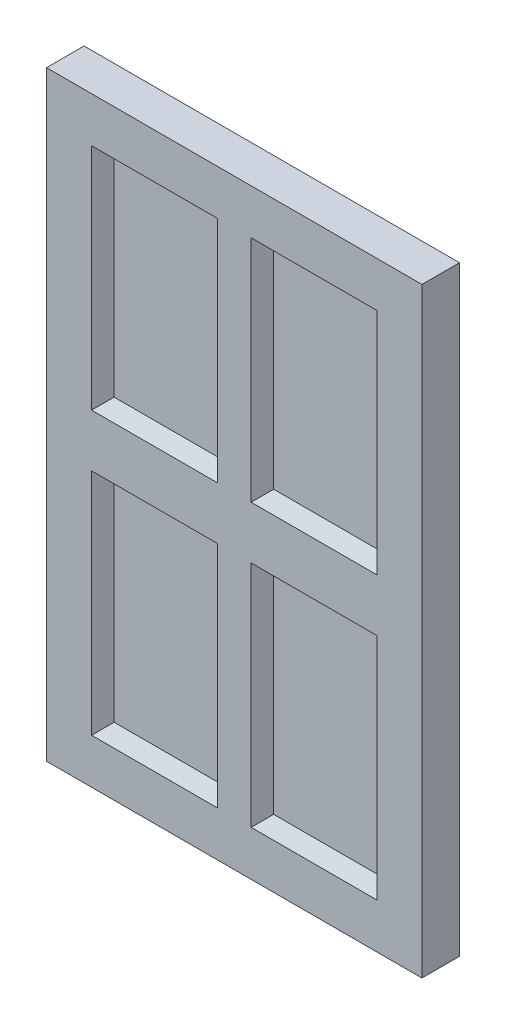
from build123d import *

# Parameters (mm, degrees)
SKETCH1_W               = 100
SKETCH1_H               = 160
BOSS_EXTRUDE1_DEPTH     = 10
SKETCH2_W               = 37.5
SKETCH2_H               = 65
CUT_EXTRUDE1_DEPTH      = 3
MIRROR6_COPY_1_SKETCH_W = 37.5
MIRROR6_COPY_1_SKETCH_H = 65
MIRROR6_COPY_1_DEPTH    = 3
MIRROR7_COPY_1_SKETCH_W = 37.5
MIRROR7_COPY_1_SKETCH_H = 65
MIRROR7_COPY_1_DEPTH    = 3
MIRROR7_COPY_2_SKETCH_W = 37.5
MIRROR7_COPY_2_SKETCH_H = 65
MIRROR7_COPY_2_DEPTH    = 3
MIRROR7_COPY_3_SKETCH_W = 37.5
MIRROR7_COPY_3_SKETCH_H = 65
MIRROR7_COPY_3_DEPTH    = 3
CHAMFER2_SIZE           = 5


with BuildPart() as part:
    # Sketch1 → Boss-Extrude1 (new body)
    with BuildSketch(Plane.XY):
        Rectangle(SKETCH1_W, SKETCH1_H)
    extrude(amount=BOSS_EXTRUDE1_DEPTH)

    # Sketch2 → Cut-Extrude1 (cut)
    with BuildSketch(Plane.XY.offset(10)):
        with Locations((21.25, 37.5)):
            Rectangle(SKETCH2_W, SKETCH2_H)
    cut_extrude1 = extrude(amount=-CUT_EXTRUDE1_DEPTH, mode=Mode.SUBTRACT)

    # Mirror5: Cut-Extrude1 across plane
    add(cut_extrude1.mirror(Plane.ZX), mode=Mode.SUBTRACT)

    # Mirror6: Cut-Extrude1 across plane
    add(cut_extrude1.mirror(Plane(origin=(0, 0, 0), x_dir=(0, 0, 1), z_dir=(1, 0, 0))), mode=Mode.SUBTRACT)

    # Mirror6 copy 1 sketch → Mirror6 copy 1 (cut)
    with BuildSketch(Plane(origin=(0, 0, 10), x_dir=(-1, 0, 0), z_dir=(0, 0, 1))):
        with Locations((21.25, 37.5)):
            Rectangle(MIRROR6_COPY_1_SKETCH_W, MIRROR6_COPY_1_SKETCH_H)
    extrude(amount=-MIRROR6_COPY_1_DEPTH, mode=Mode.SUBTRACT)

    # Mirror7: Cut-Extrude1 across plane
    add(cut_extrude1.mirror(Plane.XY.offset(5)), mode=Mode.SUBTRACT)

    # Mirror7 copy 1 sketch → Mirror7 copy 1 (cut)
    with BuildSketch(Plane(origin=(0, 0, 0), x_dir=(1, 0, 0), z_dir=(0, 0, -1))):
        with Locations((21.25, 37.5)):
            Rectangle(MIRROR7_COPY_1_SKETCH_W, MIRROR7_COPY_1_SKETCH_H)
    extrude(amount=-MIRROR7_COPY_1_DEPTH, mode=Mode.SUBTRACT)

    # Mirror7 copy 2 sketch → Mirror7 copy 2 (cut)
    with BuildSketch(Plane(origin=(0, 0, 0), x_dir=(-1, 0, 0), z_dir=(0, 0, -1))):
        with Locations((21.25, 37.5)):
            Rectangle(MIRROR7_COPY_2_SKETCH_W, MIRROR7_COPY_2_SKETCH_H)
    extrude(amount=-MIRROR7_COPY_2_DEPTH, mode=Mode.SUBTRACT)

    # Mirror7 copy 3 sketch → Mirror7 copy 3 (cut)
    with BuildSketch(Plane(origin=(0, 0, 0), x_dir=(-1, 0, 0), z_dir=(0, 0, -1))):
        with Locations((21.25, -37.5)):
            Rectangle(MIRROR7_COPY_3_SKETCH_W, MIRROR7_COPY_3_SKETCH_H)
    extrude(amount=-MIRROR7_COPY_3_DEPTH, mode=Mode.SUBTRACT)

    # Chamfer2
    # the kernel refuses this chamfer: 5 mm, written as the material it adds along each edge
    with BuildSketch(Plane(origin=(10.35841494, -5, 3), x_dir=(0, 0.027495876610586317, -0.9996219169112968), z_dir=(-1, 0, 0))) as chamfer2_piece_1_section:
        Polygon((CHAMFER2_SIZE * 0.999621916911, CHAMFER2_SIZE * 0.0274958766106), (-CHAMFER2_SIZE * 0.0274958766106, CHAMFER2_SIZE * 0.999621916911), (0, 0), align=None)
    chamfer2_piece_1 = extrude(amount=50.35841494, mode=Mode.PRIVATE)
    chamfer2_piece_1 = split(chamfer2_piece_1, bisect_by=Plane(origin=(6.42920747, -6.857142857, 0), z_dir=(0, 0, 1)), keep=Keep.TOP, mode=Mode.PRIVATE)
    add(chamfer2_piece_1)
    with BuildSketch(Plane(origin=(-40, 7.85841494, 3), x_dir=(-0.027495876610586317, 0, -0.9996219169112968), z_dir=(0, -1, 0))) as chamfer2_piece_2_section:
        Polygon((CHAMFER2_SIZE * 0.999621916911, CHAMFER2_SIZE * 0.0274958766106), (-CHAMFER2_SIZE * 0.0274958766106, CHAMFER2_SIZE * 0.999621916911), (0, 0), align=None)
    chamfer2_piece_2 = extrude(amount=77.85841494, mode=Mode.PRIVATE)
    chamfer2_piece_2 = split(chamfer2_piece_2, bisect_by=Plane(origin=(-38.142857143, 6.42920747, 0), z_dir=(0, 0, 1)), keep=Keep.TOP, mode=Mode.PRIVATE)
    add(chamfer2_piece_2)
    with BuildSketch(Plane(origin=(-40, -70, 3), x_dir=(0, -0.0274958766105877, -0.9996219169112968), z_dir=(1, 0, 0))) as chamfer2_piece_3_section:
        Polygon((CHAMFER2_SIZE * 0.999621916911, CHAMFER2_SIZE * 0.0274958766106), (-CHAMFER2_SIZE * 0.0274958766106, CHAMFER2_SIZE * 0.999621916911), (0, 0), align=None)
    chamfer2_piece_3 = extrude(amount=50.35841494, mode=Mode.PRIVATE)
    chamfer2_piece_3 = split(chamfer2_piece_3, bisect_by=Plane(origin=(-21.25, -68.142857143, 0), z_dir=(0, 0, 1)), keep=Keep.TOP, mode=Mode.PRIVATE)
    add(chamfer2_piece_3)
    with BuildSketch(Plane(origin=(-2.5, -70, 3), x_dir=(0.027495876610586403, 0, -0.9996219169112968), z_dir=(0, 1, 0))) as chamfer2_piece_4_section:
        Polygon((CHAMFER2_SIZE * 0.999621916911, CHAMFER2_SIZE * 0.0274958766106), (-CHAMFER2_SIZE * 0.0274958766106, CHAMFER2_SIZE * 0.999621916911), (0, 0), align=None)
    chamfer2_piece_4 = extrude(amount=77.85841494, mode=Mode.PRIVATE)
    chamfer2_piece_4 = split(chamfer2_piece_4, bisect_by=Plane(origin=(-4.357142857, -37.5, 0), z_dir=(0, 0, 1)), keep=Keep.TOP, mode=Mode.PRIVATE)
    add(chamfer2_piece_4)
    with BuildSketch(Plane(origin=(-40, -70, 7), x_dir=(0, -0.0274958766105877, 0.9996219169112968), z_dir=(1, 0, 0))) as chamfer2_piece_5_section:
        Polygon((CHAMFER2_SIZE * 0.999621916911, -CHAMFER2_SIZE * 0.0274958766106), (-CHAMFER2_SIZE * 0.0274958766106, -CHAMFER2_SIZE * 0.999621916911), (0, 0), align=None)
    chamfer2_piece_5 = extrude(amount=50.35841494, mode=Mode.PRIVATE)
    chamfer2_piece_5 = split(chamfer2_piece_5, bisect_by=Plane(origin=(-21.25, -68.142857143, 10), z_dir=(0, 0, -1)), keep=Keep.TOP, mode=Mode.PRIVATE)
    add(chamfer2_piece_5)
    with BuildSketch(Plane(origin=(-40, 7.85841494, 7), x_dir=(-0.027495876610586317, 0, 0.9996219169112968), z_dir=(0, -1, 0))) as chamfer2_piece_6_section:
        Polygon((CHAMFER2_SIZE * 0.999621916911, -CHAMFER2_SIZE * 0.0274958766106), (-CHAMFER2_SIZE * 0.0274958766106, -CHAMFER2_SIZE * 0.999621916911), (0, 0), align=None)
    chamfer2_piece_6 = extrude(amount=77.85841494, mode=Mode.PRIVATE)
    chamfer2_piece_6 = split(chamfer2_piece_6, bisect_by=Plane(origin=(-38.142857143, 6.42920747, 10), z_dir=(0, 0, -1)), keep=Keep.TOP, mode=Mode.PRIVATE)
    add(chamfer2_piece_6)
    with BuildSketch(Plane(origin=(10.35841494, -5, 7), x_dir=(0, 0.027495876610586317, 0.9996219169112968), z_dir=(-1, 0, 0))) as chamfer2_piece_7_section:
        Polygon((CHAMFER2_SIZE * 0.999621916911, -CHAMFER2_SIZE * 0.0274958766106), (-CHAMFER2_SIZE * 0.0274958766106, -CHAMFER2_SIZE * 0.999621916911), (0, 0), align=None)
    chamfer2_piece_7 = extrude(amount=50.35841494, mode=Mode.PRIVATE)
    chamfer2_piece_7 = split(chamfer2_piece_7, bisect_by=Plane(origin=(6.42920747, -6.857142857, 10), z_dir=(0, 0, -1)), keep=Keep.TOP, mode=Mode.PRIVATE)
    add(chamfer2_piece_7)
    with BuildSketch(Plane(origin=(-2.5, -70, 7), x_dir=(0.027495876610586403, 0, 0.9996219169112968), z_dir=(0, 1, 0))) as chamfer2_piece_8_section:
        Polygon((CHAMFER2_SIZE * 0.999621916911, -CHAMFER2_SIZE * 0.0274958766106), (-CHAMFER2_SIZE * 0.0274958766106, -CHAMFER2_SIZE * 0.999621916911), (0, 0), align=None)
    chamfer2_piece_8 = extrude(amount=77.85841494, mode=Mode.PRIVATE)
    chamfer2_piece_8 = split(chamfer2_piece_8, bisect_by=Plane(origin=(-4.357142857, -37.5, 10), z_dir=(0, 0, -1)), keep=Keep.TOP, mode=Mode.PRIVATE)
    add(chamfer2_piece_8)
    with BuildSketch(Plane(origin=(-10.35841494, 5, 3), x_dir=(0, -0.027495876610586317, -0.9996219169112968), z_dir=(1, 0, 0))) as chamfer2_piece_9_section:
        Polygon((CHAMFER2_SIZE * 0.999621916911, CHAMFER2_SIZE * 0.0274958766106), (-CHAMFER2_SIZE * 0.0274958766106, CHAMFER2_SIZE * 0.999621916911), (0, 0), align=None)
    chamfer2_piece_9 = extrude(amount=50.35841494, mode=Mode.PRIVATE)
    chamfer2_piece_9 = split(chamfer2_piece_9, bisect_by=Plane(origin=(-6.42920747, 6.857142857, 0), z_dir=(0, 0, 1)), keep=Keep.TOP, mode=Mode.PRIVATE)
    add(chamfer2_piece_9)
    with BuildSketch(Plane(origin=(40, -7.85841494, 3), x_dir=(0.027495876610586317, 0, -0.9996219169112968), z_dir=(0, 1, 0))) as chamfer2_piece_10_section:
        Polygon((CHAMFER2_SIZE * 0.999621916911, CHAMFER2_SIZE * 0.0274958766106), (-CHAMFER2_SIZE * 0.0274958766106, CHAMFER2_SIZE * 0.999621916911), (0, 0), align=None)
    chamfer2_piece_10 = extrude(amount=77.85841494, mode=Mode.PRIVATE)
    chamfer2_piece_10 = split(chamfer2_piece_10, bisect_by=Plane(origin=(38.142857143, -6.42920747, 0), z_dir=(0, 0, 1)), keep=Keep.TOP, mode=Mode.PRIVATE)
    add(chamfer2_piece_10)
    with BuildSketch(Plane(origin=(40, 70, 3), x_dir=(0, 0.0274958766105877, -0.9996219169112968), z_dir=(-1, 0, 0))) as chamfer2_piece_11_section:
        Polygon((CHAMFER2_SIZE * 0.999621916911, CHAMFER2_SIZE * 0.0274958766106), (-CHAMFER2_SIZE * 0.0274958766106, CHAMFER2_SIZE * 0.999621916911), (0, 0), align=None)
    chamfer2_piece_11 = extrude(amount=50.35841494, mode=Mode.PRIVATE)
    chamfer2_piece_11 = split(chamfer2_piece_11, bisect_by=Plane(origin=(21.25, 68.142857143, 0), z_dir=(0, 0, 1)), keep=Keep.TOP, mode=Mode.PRIVATE)
    add(chamfer2_piece_11)
    with BuildSketch(Plane(origin=(2.5, 70, 3), x_dir=(-0.027495876610586403, 0, -0.9996219169112968), z_dir=(0, -1, 0))) as chamfer2_piece_12_section:
        Polygon((CHAMFER2_SIZE * 0.999621916911, CHAMFER2_SIZE * 0.0274958766106), (-CHAMFER2_SIZE * 0.0274958766106, CHAMFER2_SIZE * 0.999621916911), (0, 0), align=None)
    chamfer2_piece_12 = extrude(amount=77.85841494, mode=Mode.PRIVATE)
    chamfer2_piece_12 = split(chamfer2_piece_12, bisect_by=Plane(origin=(4.357142857, 37.5, 0), z_dir=(0, 0, 1)), keep=Keep.TOP, mode=Mode.PRIVATE)
    add(chamfer2_piece_12)
    with BuildSketch(Plane(origin=(-40, 70, 3), x_dir=(0, 0.0274958766105877, -0.9996219169112968), z_dir=(1, 0, 0))) as chamfer2_piece_13_section:
        Polygon((CHAMFER2_SIZE * 0.999621916911, -CHAMFER2_SIZE * 0.0274958766106), (-CHAMFER2_SIZE * 0.0274958766106, -CHAMFER2_SIZE * 0.999621916911), (0, 0), align=None)
    chamfer2_piece_13 = extrude(amount=50.35841494, mode=Mode.PRIVATE)
    chamfer2_piece_13 = split(chamfer2_piece_13, bisect_by=Plane(origin=(-21.25, 68.142857143, 0), z_dir=(0, 0, 1)), keep=Keep.TOP, mode=Mode.PRIVATE)
    add(chamfer2_piece_13)
    with BuildSketch(Plane(origin=(-40, -7.85841494, 3), x_dir=(-0.027495876610586317, 0, -0.9996219169112968), z_dir=(0, 1, 0))) as chamfer2_piece_14_section:
        Polygon((CHAMFER2_SIZE * 0.999621916911, -CHAMFER2_SIZE * 0.0274958766106), (-CHAMFER2_SIZE * 0.0274958766106, -CHAMFER2_SIZE * 0.999621916911), (0, 0), align=None)
    chamfer2_piece_14 = extrude(amount=77.85841494, mode=Mode.PRIVATE)
    chamfer2_piece_14 = split(chamfer2_piece_14, bisect_by=Plane(origin=(-38.142857143, -6.42920747, 0), z_dir=(0, 0, 1)), keep=Keep.TOP, mode=Mode.PRIVATE)
    add(chamfer2_piece_14)
    with BuildSketch(Plane(origin=(10.35841494, 5, 3), x_dir=(0, -0.027495876610586317, -0.9996219169112968), z_dir=(-1, 0, 0))) as chamfer2_piece_15_section:
        Polygon((CHAMFER2_SIZE * 0.999621916911, -CHAMFER2_SIZE * 0.0274958766106), (-CHAMFER2_SIZE * 0.0274958766106, -CHAMFER2_SIZE * 0.999621916911), (0, 0), align=None)
    chamfer2_piece_15 = extrude(amount=50.35841494, mode=Mode.PRIVATE)
    chamfer2_piece_15 = split(chamfer2_piece_15, bisect_by=Plane(origin=(6.42920747, 6.857142857, 0), z_dir=(0, 0, 1)), keep=Keep.TOP, mode=Mode.PRIVATE)
    add(chamfer2_piece_15)
    with BuildSketch(Plane(origin=(-2.5, 70, 3), x_dir=(0.027495876610586403, 0, -0.9996219169112968), z_dir=(0, -1, 0))) as chamfer2_piece_16_section:
        Polygon((CHAMFER2_SIZE * 0.999621916911, -CHAMFER2_SIZE * 0.0274958766106), (-CHAMFER2_SIZE * 0.0274958766106, -CHAMFER2_SIZE * 0.999621916911), (0, 0), align=None)
    chamfer2_piece_16 = extrude(amount=77.85841494, mode=Mode.PRIVATE)
    chamfer2_piece_16 = split(chamfer2_piece_16, bisect_by=Plane(origin=(-4.357142857, 37.5, 0), z_dir=(0, 0, 1)), keep=Keep.TOP, mode=Mode.PRIVATE)
    add(chamfer2_piece_16)
    with BuildSketch(Plane(origin=(40, -70, 3), x_dir=(0, -0.0274958766105877, -0.9996219169112968), z_dir=(-1, 0, 0))) as chamfer2_piece_17_section:
        Polygon((CHAMFER2_SIZE * 0.999621916911, -CHAMFER2_SIZE * 0.0274958766106), (-CHAMFER2_SIZE * 0.0274958766106, -CHAMFER2_SIZE * 0.999621916911), (0, 0), align=None)
    chamfer2_piece_17 = extrude(amount=50.35841494, mode=Mode.PRIVATE)
    chamfer2_piece_17 = split(chamfer2_piece_17, bisect_by=Plane(origin=(21.25, -68.142857143, 0), z_dir=(0, 0, 1)), keep=Keep.TOP, mode=Mode.PRIVATE)
    add(chamfer2_piece_17)
    with BuildSketch(Plane(origin=(40, 7.85841494, 3), x_dir=(0.027495876610586317, 0, -0.9996219169112968), z_dir=(0, -1, 0))) as chamfer2_piece_18_section:
        Polygon((CHAMFER2_SIZE * 0.999621916911, -CHAMFER2_SIZE * 0.0274958766106), (-CHAMFER2_SIZE * 0.0274958766106, -CHAMFER2_SIZE * 0.999621916911), (0, 0), align=None)
    chamfer2_piece_18 = extrude(amount=77.85841494, mode=Mode.PRIVATE)
    chamfer2_piece_18 = split(chamfer2_piece_18, bisect_by=Plane(origin=(38.142857143, 6.42920747, 0), z_dir=(0, 0, 1)), keep=Keep.TOP, mode=Mode.PRIVATE)
    add(chamfer2_piece_18)
    with BuildSketch(Plane(origin=(-10.35841494, -5, 3), x_dir=(0, 0.027495876610586317, -0.9996219169112968), z_dir=(1, 0, 0))) as chamfer2_piece_19_section:
        Polygon((CHAMFER2_SIZE * 0.999621916911, -CHAMFER2_SIZE * 0.0274958766106), (-CHAMFER2_SIZE * 0.0274958766106, -CHAMFER2_SIZE * 0.999621916911), (0, 0), align=None)
    chamfer2_piece_19 = extrude(amount=50.35841494, mode=Mode.PRIVATE)
    chamfer2_piece_19 = split(chamfer2_piece_19, bisect_by=Plane(origin=(-6.42920747, -6.857142857, 0), z_dir=(0, 0, 1)), keep=Keep.TOP, mode=Mode.PRIVATE)
    add(chamfer2_piece_19)
    with BuildSketch(Plane(origin=(2.5, -70, 3), x_dir=(-0.027495876610586403, 0, -0.9996219169112968), z_dir=(0, 1, 0))) as chamfer2_piece_20_section:
        Polygon((CHAMFER2_SIZE * 0.999621916911, -CHAMFER2_SIZE * 0.0274958766106), (-CHAMFER2_SIZE * 0.0274958766106, -CHAMFER2_SIZE * 0.999621916911), (0, 0), align=None)
    chamfer2_piece_20 = extrude(amount=77.85841494, mode=Mode.PRIVATE)
    chamfer2_piece_20 = split(chamfer2_piece_20, bisect_by=Plane(origin=(4.357142857, -37.5, 0), z_dir=(0, 0, 1)), keep=Keep.TOP, mode=Mode.PRIVATE)
    add(chamfer2_piece_20)
    with BuildSketch(Plane(origin=(-10.35841494, -5, 7), x_dir=(0, 0.027495876610586317, 0.9996219169112968), z_dir=(1, 0, 0))) as chamfer2_piece_21_section:
        Polygon((CHAMFER2_SIZE * 0.999621916911, CHAMFER2_SIZE * 0.0274958766106), (-CHAMFER2_SIZE * 0.0274958766106, CHAMFER2_SIZE * 0.999621916911), (0, 0), align=None)
    chamfer2_piece_21 = extrude(amount=50.35841494, mode=Mode.PRIVATE)
    chamfer2_piece_21 = split(chamfer2_piece_21, bisect_by=Plane(origin=(-6.42920747, -6.857142857, 10), z_dir=(0, 0, -1)), keep=Keep.TOP, mode=Mode.PRIVATE)
    add(chamfer2_piece_21)
    with BuildSketch(Plane(origin=(40, 7.85841494, 7), x_dir=(0.027495876610586317, 0, 0.9996219169112968), z_dir=(0, -1, 0))) as chamfer2_piece_22_section:
        Polygon((CHAMFER2_SIZE * 0.999621916911, CHAMFER2_SIZE * 0.0274958766106), (-CHAMFER2_SIZE * 0.0274958766106, CHAMFER2_SIZE * 0.999621916911), (0, 0), align=None)
    chamfer2_piece_22 = extrude(amount=77.85841494, mode=Mode.PRIVATE)
    chamfer2_piece_22 = split(chamfer2_piece_22, bisect_by=Plane(origin=(38.142857143, 6.42920747, 10), z_dir=(0, 0, -1)), keep=Keep.TOP, mode=Mode.PRIVATE)
    add(chamfer2_piece_22)
    with BuildSketch(Plane(origin=(40, -70, 7), x_dir=(0, -0.0274958766105877, 0.9996219169112968), z_dir=(-1, 0, 0))) as chamfer2_piece_23_section:
        Polygon((CHAMFER2_SIZE * 0.999621916911, CHAMFER2_SIZE * 0.0274958766106), (-CHAMFER2_SIZE * 0.0274958766106, CHAMFER2_SIZE * 0.999621916911), (0, 0), align=None)
    chamfer2_piece_23 = extrude(amount=50.35841494, mode=Mode.PRIVATE)
    chamfer2_piece_23 = split(chamfer2_piece_23, bisect_by=Plane(origin=(21.25, -68.142857143, 10), z_dir=(0, 0, -1)), keep=Keep.TOP, mode=Mode.PRIVATE)
    add(chamfer2_piece_23)
    with BuildSketch(Plane(origin=(2.5, -70, 7), x_dir=(-0.027495876610586403, 0, 0.9996219169112968), z_dir=(0, 1, 0))) as chamfer2_piece_24_section:
        Polygon((CHAMFER2_SIZE * 0.999621916911, CHAMFER2_SIZE * 0.0274958766106), (-CHAMFER2_SIZE * 0.0274958766106, CHAMFER2_SIZE * 0.999621916911), (0, 0), align=None)
    chamfer2_piece_24 = extrude(amount=77.85841494, mode=Mode.PRIVATE)
    chamfer2_piece_24 = split(chamfer2_piece_24, bisect_by=Plane(origin=(4.357142857, -37.5, 10), z_dir=(0, 0, -1)), keep=Keep.TOP, mode=Mode.PRIVATE)
    add(chamfer2_piece_24)
    with BuildSketch(Plane(origin=(40, 70, 7), x_dir=(0, 0.0274958766105877, 0.9996219169112968), z_dir=(-1, 0, 0))) as chamfer2_piece_25_section:
        Polygon((CHAMFER2_SIZE * 0.999621916911, -CHAMFER2_SIZE * 0.0274958766106), (-CHAMFER2_SIZE * 0.0274958766106, -CHAMFER2_SIZE * 0.999621916911), (0, 0), align=None)
    chamfer2_piece_25 = extrude(amount=50.35841494, mode=Mode.PRIVATE)
    chamfer2_piece_25 = split(chamfer2_piece_25, bisect_by=Plane(origin=(21.25, 68.142857143, 10), z_dir=(0, 0, -1)), keep=Keep.TOP, mode=Mode.PRIVATE)
    add(chamfer2_piece_25)
    with BuildSketch(Plane(origin=(40, -7.85841494, 7), x_dir=(0.027495876610586317, 0, 0.9996219169112968), z_dir=(0, 1, 0))) as chamfer2_piece_26_section:
        Polygon((CHAMFER2_SIZE * 0.999621916911, -CHAMFER2_SIZE * 0.0274958766106), (-CHAMFER2_SIZE * 0.0274958766106, -CHAMFER2_SIZE * 0.999621916911), (0, 0), align=None)
    chamfer2_piece_26 = extrude(amount=77.85841494, mode=Mode.PRIVATE)
    chamfer2_piece_26 = split(chamfer2_piece_26, bisect_by=Plane(origin=(38.142857143, -6.42920747, 10), z_dir=(0, 0, -1)), keep=Keep.TOP, mode=Mode.PRIVATE)
    add(chamfer2_piece_26)
    with BuildSketch(Plane(origin=(-10.35841494, 5, 7), x_dir=(0, -0.027495876610586317, 0.9996219169112968), z_dir=(1, 0, 0))) as chamfer2_piece_27_section:
        Polygon((CHAMFER2_SIZE * 0.999621916911, -CHAMFER2_SIZE * 0.0274958766106), (-CHAMFER2_SIZE * 0.0274958766106, -CHAMFER2_SIZE * 0.999621916911), (0, 0), align=None)
    chamfer2_piece_27 = extrude(amount=50.35841494, mode=Mode.PRIVATE)
    chamfer2_piece_27 = split(chamfer2_piece_27, bisect_by=Plane(origin=(-6.42920747, 6.857142857, 10), z_dir=(0, 0, -1)), keep=Keep.TOP, mode=Mode.PRIVATE)
    add(chamfer2_piece_27)
    with BuildSketch(Plane(origin=(2.5, 70, 7), x_dir=(-0.027495876610586403, 0, 0.9996219169112968), z_dir=(0, -1, 0))) as chamfer2_piece_28_section:
        Polygon((CHAMFER2_SIZE * 0.999621916911, -CHAMFER2_SIZE * 0.0274958766106), (-CHAMFER2_SIZE * 0.0274958766106, -CHAMFER2_SIZE * 0.999621916911), (0, 0), align=None)
    chamfer2_piece_28 = extrude(amount=77.85841494, mode=Mode.PRIVATE)
    chamfer2_piece_28 = split(chamfer2_piece_28, bisect_by=Plane(origin=(4.357142857, 37.5, 10), z_dir=(0, 0, -1)), keep=Keep.TOP, mode=Mode.PRIVATE)
    add(chamfer2_piece_28)
    with BuildSketch(Plane(origin=(10.35841494, 5, 7), x_dir=(0, -0.027495876610586317, 0.9996219169112968), z_dir=(-1, 0, 0))) as chamfer2_piece_29_section:
        Polygon((CHAMFER2_SIZE * 0.999621916911, CHAMFER2_SIZE * 0.0274958766106), (-CHAMFER2_SIZE * 0.0274958766106, CHAMFER2_SIZE * 0.999621916911), (0, 0), align=None)
    chamfer2_piece_29 = extrude(amount=50.35841494, mode=Mode.PRIVATE)
    chamfer2_piece_29 = split(chamfer2_piece_29, bisect_by=Plane(origin=(6.42920747, 6.857142857, 10), z_dir=(0, 0, -1)), keep=Keep.TOP, mode=Mode.PRIVATE)
    add(chamfer2_piece_29)
    with BuildSketch(Plane(origin=(-40, -7.85841494, 7), x_dir=(-0.027495876610586317, 0, 0.9996219169112968), z_dir=(0, 1, 0))) as chamfer2_piece_30_section:
        Polygon((CHAMFER2_SIZE * 0.999621916911, CHAMFER2_SIZE * 0.0274958766106), (-CHAMFER2_SIZE * 0.0274958766106, CHAMFER2_SIZE * 0.999621916911), (0, 0), align=None)
    chamfer2_piece_30 = extrude(amount=77.85841494, mode=Mode.PRIVATE)
    chamfer2_piece_30 = split(chamfer2_piece_30, bisect_by=Plane(origin=(-38.142857143, -6.42920747, 10), z_dir=(0, 0, -1)), keep=Keep.TOP, mode=Mode.PRIVATE)
    add(chamfer2_piece_30)
    with BuildSketch(Plane(origin=(-40, 70, 7), x_dir=(0, 0.0274958766105877, 0.9996219169112968), z_dir=(1, 0, 0))) as chamfer2_piece_31_section:
        Polygon((CHAMFER2_SIZE * 0.999621916911, CHAMFER2_SIZE * 0.0274958766106), (-CHAMFER2_SIZE * 0.0274958766106, CHAMFER2_SIZE * 0.999621916911), (0, 0), align=None)
    chamfer2_piece_31 = extrude(amount=50.35841494, mode=Mode.PRIVATE)
    chamfer2_piece_31 = split(chamfer2_piece_31, bisect_by=Plane(origin=(-21.25, 68.142857143, 10), z_dir=(0, 0, -1)), keep=Keep.TOP, mode=Mode.PRIVATE)
    add(chamfer2_piece_31)
    with BuildSketch(Plane(origin=(-2.5, 70, 7), x_dir=(0.027495876610586403, 0, 0.9996219169112968), z_dir=(0, -1, 0))) as chamfer2_piece_32_section:
        Polygon((CHAMFER2_SIZE * 0.999621916911, CHAMFER2_SIZE * 0.0274958766106), (-CHAMFER2_SIZE * 0.0274958766106, CHAMFER2_SIZE * 0.999621916911), (0, 0), align=None)
    chamfer2_piece_32 = extrude(amount=77.85841494, mode=Mode.PRIVATE)
    chamfer2_piece_32 = split(chamfer2_piece_32, bisect_by=Plane(origin=(-4.357142857, 37.5, 10), z_dir=(0, 0, -1)), keep=Keep.TOP, mode=Mode.PRIVATE)
    add(chamfer2_piece_32)


solid = part.part
